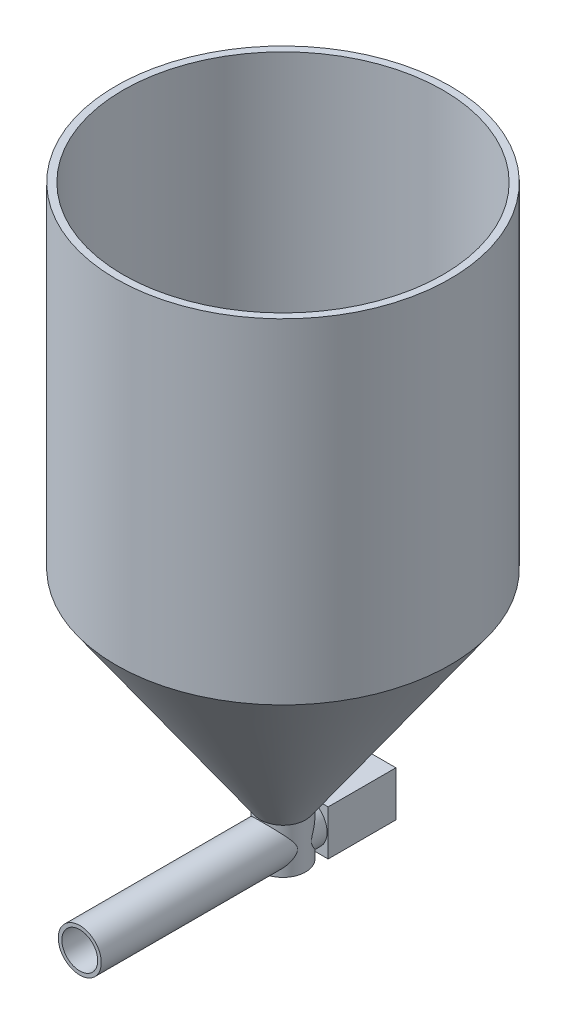
from build123d import *
from build123d.topology import SkipClean

# Parameters (mm, degrees)
CROQUIS1_R              = 148
SALIENTE_EXTRUIR1_DEPTH = 296.2
CROQUIS3_R              = 20
CROQUIS2_R              = 148
CROQUIS4_R              = 20
SALIENTE_EXTRUIR2_DEPTH = 40
CROQUIS5_R              = 19.05
SALIENTE_EXTRUIR3_DEPTH = 200
CROQUIS6_W              = 40
CROQUIS6_H              = 40
SALIENTE_EXTRUIR4_DEPTH = 60
VACIADO1_START          = -13.65
VACIADO1_OUTLINE_R      = 12.7
VACIADO1_DEPTH          = 193.65
CROQUIS7_R              = 15.875
CORTAR_EXTRUIR1_DEPTH   = 403


with BuildPart() as part:
    # Croquis1 → Saliente-Extruir1 (new body)
    with BuildSketch(Plane(origin=(0, 0, 0), x_dir=(1, 0, 0), z_dir=(0, 1, 0))):
        with Locations(Location((0, 0, 0), (0, 0, 270))):
            Circle(CROQUIS1_R)
    extrude(amount=-SALIENTE_EXTRUIR1_DEPTH)

    # Croquis3 → Recubrir1 section 0
    with BuildSketch(Plane(origin=(0, -479, 0), x_dir=(1, 0, 0), z_dir=(0, 1, 0))):
        Circle(CROQUIS3_R)
    # Croquis2 → Recubrir1 section 1
    with BuildSketch(Plane.XZ.offset(296.2)):
        Circle(CROQUIS2_R)
    loft()

    # Croquis4 → Saliente-Extruir2 (add)
    with BuildSketch(Plane.XZ.offset(479)):
        with Locations(Location((0, 0, 0), (0, 0, 270))):
            Circle(CROQUIS4_R)
    extrude(amount=SALIENTE_EXTRUIR2_DEPTH)

    # Croquis5 → Saliente-Extruir3 (add)
    with BuildSketch(Plane(origin=(0, 0, -20), x_dir=(-1, 0, 0), z_dir=(0, 0, -1))):
        with Locations((0, -499)):
            Circle(CROQUIS5_R)
    extrude(amount=-SALIENTE_EXTRUIR3_DEPTH)

    # Vaciado1: read off the stored shape, not the designer's step
    # Vaciado1 outline → Vaciado1 (cut)
    with BuildSketch(Plane.XY.offset(VACIADO1_START)):
        with Locations((0, -499)):
            Circle(VACIADO1_OUTLINE_R)
    extrude(amount=VACIADO1_DEPTH, mode=Mode.SUBTRACT)

    # Vaciado1 2 outline → Vaciado1 2 (revolve, cut)
    with SkipClean():  # the faces are left unmerged after this step: merging them gives an invalid solid
        with BuildSketch(Plane.XY):
            Polygon((13.65, -476.99782627), (141.65, -294.19782627), (141.65, 0), (0, 0), (0, -512.65), (13.65, -512.65), align=None)
        revolve(axis=Axis((0, 0, 0), (0, 1, 0)), mode=Mode.SUBTRACT)


with BuildPart() as body_2:
    # Croquis6 → Saliente-Extruir4 (new body)
    with BuildSketch(Plane(origin=(0, 0, -20), x_dir=(-1, 0, 0), z_dir=(0, 0, -1))):
        with Locations((0, -499)):
            Rectangle(CROQUIS6_W, CROQUIS6_H)
    extrude(amount=SALIENTE_EXTRUIR4_DEPTH)


with BuildPart() as cortar_extruir1_tool:
    # Croquis7 → Cortar-Extruir1 (new body)
    with BuildSketch(Plane.XY.offset(180)):
        with Locations((0, -499)):
            Circle(CROQUIS7_R)
    extrude(amount=-CORTAR_EXTRUIR1_DEPTH)


with BuildPart() as part_1:
    add(part.part)

    # Cortar-Extruir1: cut by cortar_extruir1_tool
    add(cortar_extruir1_tool.part, mode=Mode.SUBTRACT)


with BuildPart() as body_2_1:
    add(body_2.part)

    # Cortar-Extruir1: cut by cortar_extruir1_tool
    add(cortar_extruir1_tool.part, mode=Mode.SUBTRACT)


solid = Compound([part_1.part, body_2_1.part])
